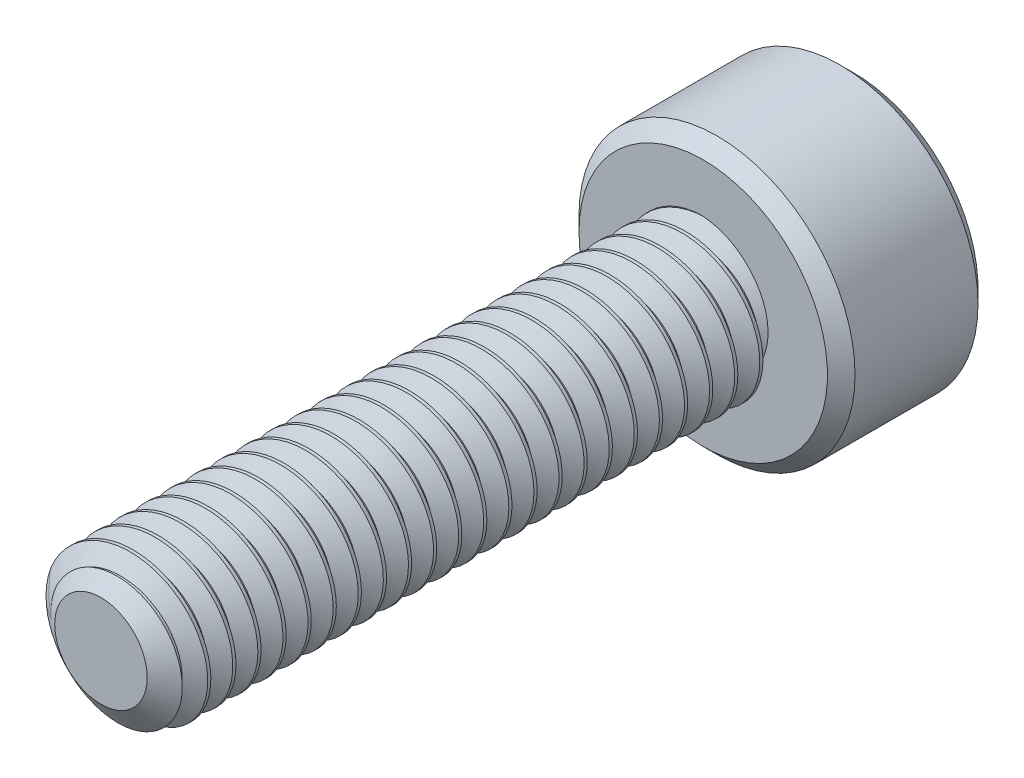
from build123d import *

# Parameters (mm, degrees)
SKETCH1_R          = 1.5
EXTRUDE1_DEPTH     = 12
CUT_SWEEP1_PITCH   = 0.5
SKETCH6_R          = 2.75
EXTRUDE2_DEPTH     = 3
CUT_EXTRUDE1_DEPTH = 1.875
CHAMFER1_SIZE      = 0.275


with BuildPart() as part:
    # Sketch1 → Extrude1 (new body)
    with BuildSketch(Plane.XY):
        Circle(SKETCH1_R)
    extrude(amount=-EXTRUDE1_DEPTH)

    # Cut-Sweep1: the profile of Sketch3 profile screwed along a right-hand helix of 25 turns, 6 arcs to a turn; built about Z, then put on its axis
    cut_sweep1_z = Axis((0, 0, 0), (0, 0, 1))
    cut_sweep1_corners = [(1.5003, 0, -0.437673205), (1.175240474, 0, -0.25), (1.175240474, 0, -0.1875), (1.5003, 0, 0.000173205)]
    with BuildLine(mode=Mode.PRIVATE) as cut_sweep1_profile:
        Line(cut_sweep1_corners[0], cut_sweep1_corners[1])
        Line(cut_sweep1_corners[1], cut_sweep1_corners[2])
        Line(cut_sweep1_corners[2], cut_sweep1_corners[3])
        Line(cut_sweep1_corners[3], cut_sweep1_corners[0])
    cut_sweep1_cap = Face(cut_sweep1_profile.wire())
    cut_sweep1_turn_angles = [0, 30, 60, 90, 120, 150, 180, 210, 240, 270, 300, 330, 360]
    cut_sweep1_turn_weights = [1, 0.8660254037844387, 1, 0.8660254037844387, 1, 0.8660254037844387, 1, 0.8660254037844387, 1, 0.8660254037844387, 1, 0.8660254037844387, 1]
    cut_sweep1_turn_rails = [Edge.make_bspline([Vector(p[0], p[1], 0).rotate(cut_sweep1_z, cut_sweep1_turn_angles[k]) / cut_sweep1_turn_weights[k] + Vector(0, 0, p[2] + CUT_SWEEP1_PITCH * cut_sweep1_turn_angles[k] / 360) for k in range(13)], [0, 0, 0, 1, 1, 2, 2, 3, 3, 4, 4, 5, 5, 6, 6, 6], 2, cut_sweep1_turn_weights) for p in cut_sweep1_corners]
    cut_sweep1_turn_sides = [Face.make_surface_from_curves(cut_sweep1_turn_rails[p[0]], cut_sweep1_turn_rails[p[1]]) for p in [(0, 1), (1, 2), (2, 3), (3, 0)]]
    cut_sweep1 = Plane(origin=(0, 0, 0), x_dir=(0, 1, 0), z_dir=(0, 0, -1)) * Solid(Shell([*[p.moved(Location((0, 0, CUT_SWEEP1_PITCH * i))) for i in range(25) for p in cut_sweep1_turn_sides], cut_sweep1_cap, cut_sweep1_cap.rotate(cut_sweep1_z, 9000).moved(Location((0, 0, CUT_SWEEP1_PITCH * 9000 / 360)))]))
    add(cut_sweep1, mode=Mode.SUBTRACT)

    # Sketch4 → Cut-Revolve1 (revolve, cut)
    with BuildSketch(Plane(origin=(0, 0, 0), x_dir=(0, 0, -1), z_dir=(1, 0, 0)), mode=Mode.PRIVATE) as cut_revolve1_sk:
        Polygon((0.405251783, 1.5), (0, 0.921240474), (0, 1.5), align=None)
    revolve(cut_revolve1_sk.sketch.rotate(Axis((0, 0, 0), (0, 0, -1)), 263.352109169), axis=Axis((0, 0, 0), (0, 0, -1)), mode=Mode.SUBTRACT)

    # Sketch6 → Extrude2 (add)
    with BuildSketch(Plane(origin=(0, 0, -12), x_dir=(-1, 0, 0), z_dir=(0, 0, -1))):
        Circle(SKETCH6_R)
    extrude(amount=EXTRUDE2_DEPTH)

    # Sketch7 → Cut-Extrude1 (cut)
    with BuildSketch(Plane(origin=(0, 0, -15), x_dir=(-1, 0, 0), z_dir=(0, 0, -1))):
        Polygon((0, 1.443375673), (-1.25, 0.721687836), (-1.25, -0.721687836), (0, -1.443375673), (1.25, -0.721687836), (1.25, 0.721687836), align=None)
    extrude(amount=-CUT_EXTRUDE1_DEPTH, mode=Mode.SUBTRACT)

    # Cut-Extrude2 cone 1 section (through the dimple's axis) → Cut-Extrude2 (revolve, cut)
    with BuildSketch(Plane(origin=(0, 0, -15), x_dir=(0, 1, 0), z_dir=(1, 0, 0))):
        Polygon((0, 0), (1.443375673, 0), (0, 1.443375673), align=None)
    revolve(axis=Axis((0, 0, -15), (0, 0, 1)), mode=Mode.SUBTRACT)

    # Chamfer1
    chamfer1_edges = [part.edges().sort_by_distance(p)[0] for p in [
        (2.75, 0, -12),
        (2.75, 0, -15),
    ]]
    chamfer(chamfer1_edges, length=CHAMFER1_SIZE)


solid = part.part
